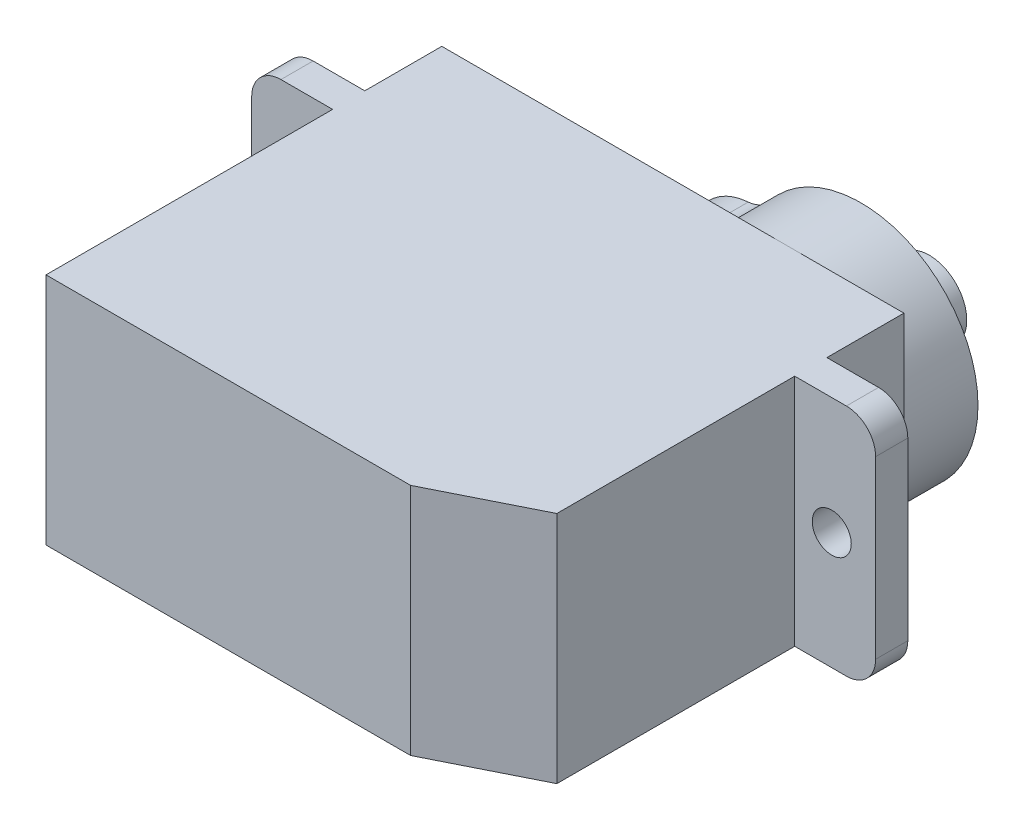
from build123d import *

# Parameters (mm, degrees)
BOSS_EXTRUDE1_DEPTH       = 6
BOSS_EXTRUDE1_DEPTH_BACK  = 6
SKETCH1_W                 = 23.7
SKETCH1_H                 = 3.95
SKETCH1_H_2               = 1.65
SKETCH1_W_2               = 4.15
FILLET1_R                 = 1.5
SKETCH2_R                 = 1
CUT_EXTRUDE1_DEPTH        = 24.65
BOSS_EXTRUDE2_DEPTH       = 3.8
FILLET2_R                 = 1.5
SKETCH4_W                 = 6
SKETCH4_H                 = 10
CUT_EXTRUDE2_DEPTH        = 0.2
SKETCH5_R                 = 1
BOSS_EXTRUDE3_DEPTH       = 0.5
SKETCH6_R                 = 1.925
BOSS_EXTRUDE4_DEPTH       = 0.5
CHAMFER1_SIZE             = 0.5
SKETCH7_R                 = 1.925
BOSS_EXTRUDE5_DEPTH       = 3
SKETCH8_R                 = 0.5
M2X0_4_TAPPED_HOLE1_D     = 1.6
M2X0_4_TAPPED_HOLE1_DEPTH = 5.2
M2X0_4_TAPPED_HOLE1_TIP   = 0.480688495


with BuildPart() as part:
    # Sketch1 → Boss-Extrude1 (new, two sides: drawn at the far end of the back side and taken through both)
    with BuildSketch(Plane(origin=(0, 0, 0), x_dir=(1, 0, 0), z_dir=(0, 1, 0)).offset(-BOSS_EXTRUDE1_DEPTH_BACK)):
        with Locations((0, 8.175)):
            Rectangle(SKETCH1_W, SKETCH1_H)
        with Locations((0, 5.375)):
            Rectangle(SKETCH1_W, SKETCH1_H_2)
        with Locations((-13.925, 5.375)):
            Rectangle(SKETCH1_W_2, SKETCH1_H_2)
        with Locations((13.925, 5.375)):
            Rectangle(SKETCH1_W_2, SKETCH1_H_2)
        Polygon((-11.85, -10.15), (6.85, -10.15), (11.85, -7.65), (11.85, 4.55), (-11.85, 4.55), align=None)
    extrude(amount=BOSS_EXTRUDE1_DEPTH + BOSS_EXTRUDE1_DEPTH_BACK)

    # Fillet1
    fillet1_edges = [part.edges().sort_by_distance(p)[0] for p in [
        (-16, -6, -5.375),
        (16, 6, -5.375),
        (-16, 6, -5.375),
        (16, -6, -5.375),
    ]]
    fillet(fillet1_edges, radius=FILLET1_R)

    # Sketch2 → Cut-Extrude1 (cut, through all)
    with BuildSketch(Plane(origin=(0, 0, -6.2), x_dir=(-1, 0, 0), z_dir=(0, 0, -1))):
        with Locations((-13.75, 0)):
            Circle(SKETCH2_R)
        with Locations((13.75, 0)):
            Circle(SKETCH2_R)
    extrude(amount=-CUT_EXTRUDE1_DEPTH, mode=Mode.SUBTRACT)

    # Sketch3 → Boss-Extrude2 (add)
    with BuildSketch(Plane(origin=(0, 0, -10.15), x_dir=(-1, 0, 0), z_dir=(0, 0, -1))):
        with BuildLine():
            ThreePointArc((-0.725675676, 3.121105608), (-0.073065435, 1.620810608), (0.15, 0))
            Line((0.15, 0), (2.85, 0))
            ThreePointArc((2.85, 0), (1.77142724, 2.373118031), (-0.725675676, 3.121105608))
        make_face()
        with BuildLine():
            ThreePointArc((-0.725675676, -3.121105608), (-0.073065435, -1.620810608), (0.15, 0))
            Line((0.15, 0), (-3.45, 0))
            ThreePointArc((-3.45, 0), (-2.673118031, -2.07142724), (-0.725675676, -3.121105608))
        make_face()
        with BuildLine():
            Line((-3.45, 0), (0.15, 0))
            ThreePointArc((0.15, 0), (-0.073065435, 1.620810608), (-0.725675676, 3.121105608))
            ThreePointArc((-0.725675676, 3.121105608), (-2.673118031, 2.07142724), (-3.45, 0))
        make_face()
        with BuildLine():
            Line((2.85, 0), (0.15, 0))
            ThreePointArc((0.15, 0), (-0.073065435, -1.620810608), (-0.725675676, -3.121105608))
            ThreePointArc((-0.725675676, -3.121105608), (1.77142724, -2.373118031), (2.85, 0))
        make_face()
        with BuildLine():
            ThreePointArc((-0.725675676, -3.121105608), (-2.673118031, -2.07142724), (-3.45, 0))
            Line((-3.45, 0), (-11.85, 0))
            ThreePointArc((-11.85, 0), (-7.470810608, -5.776934565), (-0.725675676, -3.121105608))
        make_face()
        with BuildLine():
            Line((-11.85, 0), (-3.45, 0))
            ThreePointArc((-3.45, 0), (-2.673118031, 2.07142724), (-0.725675676, 3.121105608))
            ThreePointArc((-0.725675676, 3.121105608), (-7.470810608, 5.776934565), (-11.85, 0))
        make_face()
    extrude(amount=BOSS_EXTRUDE2_DEPTH)

    # Fillet2
    fillet2_edges = [part.edges().sort_by_distance(p)[0] for p in [
        (0.725675676, 3.121105608, -12.05),
        (0.725675676, -3.121105608, -12.05),
    ]]
    fillet(fillet2_edges, radius=FILLET2_R)

    # Sketch4 → Cut-Extrude2 (cut)
    with BuildSketch(Plane(origin=(0, 0, -10.15), x_dir=(-1, 0, 0), z_dir=(0, 0, -1))):
        with Locations((6.85, 0)):
            Rectangle(SKETCH4_W, SKETCH4_H)
    extrude(amount=-CUT_EXTRUDE2_DEPTH, mode=Mode.SUBTRACT)

    # Sketch5 → Boss-Extrude3 (add)
    with BuildSketch(Plane(origin=(0, 0, -13.95), x_dir=(-1, 0, 0), z_dir=(0, 0, -1))):
        Circle(SKETCH5_R)
    extrude(amount=BOSS_EXTRUDE3_DEPTH)

    # Sketch6 → Boss-Extrude4 (add)
    with BuildSketch(Plane(origin=(0, 0, -13.95), x_dir=(-1, 0, 0), z_dir=(0, 0, -1))):
        with Locations((-5.85, 0)):
            Circle(SKETCH6_R)
    extrude(amount=BOSS_EXTRUDE4_DEPTH)

    # Chamfer1
    chamfer1_edges = [part.edges().sort_by_distance(p)[0] for p in [
        (7.775, 0, -13.95),
    ]]
    chamfer(chamfer1_edges, length=CHAMFER1_SIZE - 0.0001)  # a hair under: the kernel refuses the full size

    # Sketch7 → Boss-Extrude5 (add)
    with BuildSketch(Plane(origin=(0, 0, -14.45), x_dir=(-1, 0, 0), z_dir=(0, 0, -1))):
        with Locations((-5.85, 0)):
            Circle(SKETCH7_R)
    extrude(amount=BOSS_EXTRUDE5_DEPTH)

    # Sketch8 → Cut-Revolve1 (revolve, cut)
    with BuildSketch(Plane(origin=(0, 0, 0), x_dir=(1, 0, 0), z_dir=(0, 1, 0)), mode=Mode.PRIVATE) as cut_revolve1_sk:
        with Locations((8.025, 14.91837485)):
            Circle(SKETCH8_R)
    revolve(cut_revolve1_sk.sketch.rotate(Axis((5.85, 0, -17.45), (0, 0, 1)), 180), axis=Axis((5.85, 0, -17.45), (0, 0, 1)), mode=Mode.SUBTRACT)

    # M2x0.4 Tapped Hole1
    with Locations(Plane(origin=(0, 0, -17.45), x_dir=(-1, 0, 0), z_dir=(0, 0, -1))):
        with Locations((-5.85, 0)):
            Hole(M2X0_4_TAPPED_HOLE1_D / 2, depth=M2X0_4_TAPPED_HOLE1_DEPTH)
            with Locations((0, 0, -(M2X0_4_TAPPED_HOLE1_DEPTH + M2X0_4_TAPPED_HOLE1_TIP / 2))):  # 118° drill point
                Cone(0, M2X0_4_TAPPED_HOLE1_D / 2, M2X0_4_TAPPED_HOLE1_TIP, mode=Mode.SUBTRACT)


solid = part.part
